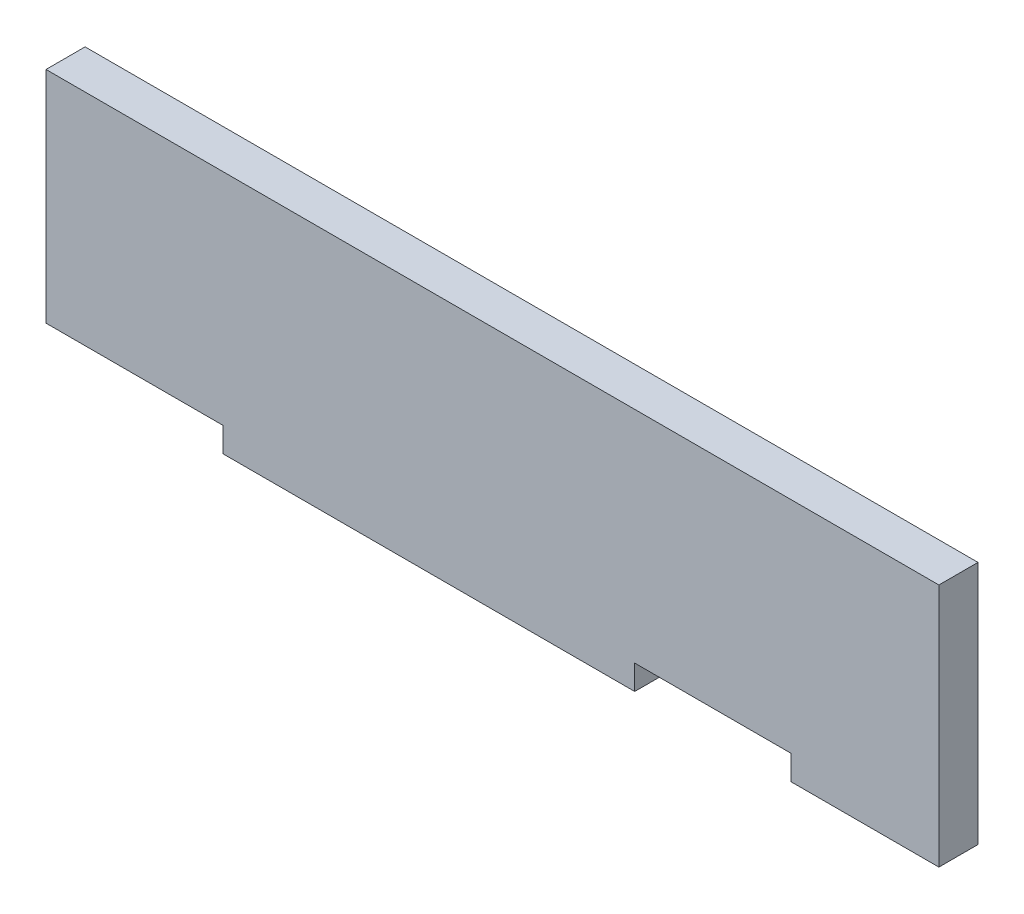
from build123d import *

# Parameters (mm, degrees)
SKETCH1_W           = 435
SKETCH1_H           = 119.05
BOSS_EXTRUDE1_DEPTH = 19.05
SKETCH2_W           = 76.2
SKETCH2_H           = 12
CUT_EXTRUDE1_DEPTH  = 324.319973092


with BuildPart() as part:
    # Sketch1 → Boss-Extrude1 (new body)
    with BuildSketch(Plane.XY):
        with Locations((82.5, 59.525)):
            Rectangle(SKETCH1_W, SKETCH1_H)
    extrude(amount=BOSS_EXTRUDE1_DEPTH)

    # Sketch2 → Cut-Extrude1 (cut, through all)
    with BuildSketch(Plane.XY.offset(19.05)):
        Polygon((-48.8, 12), (-125, 12), (-135, 12), (-135, 0), (-125, 0), (-48.8, 0), align=None)
        with Locations((189.9, 6)):
            Rectangle(SKETCH2_W, SKETCH2_H)
    extrude(amount=-CUT_EXTRUDE1_DEPTH, mode=Mode.SUBTRACT)


solid = part.part
